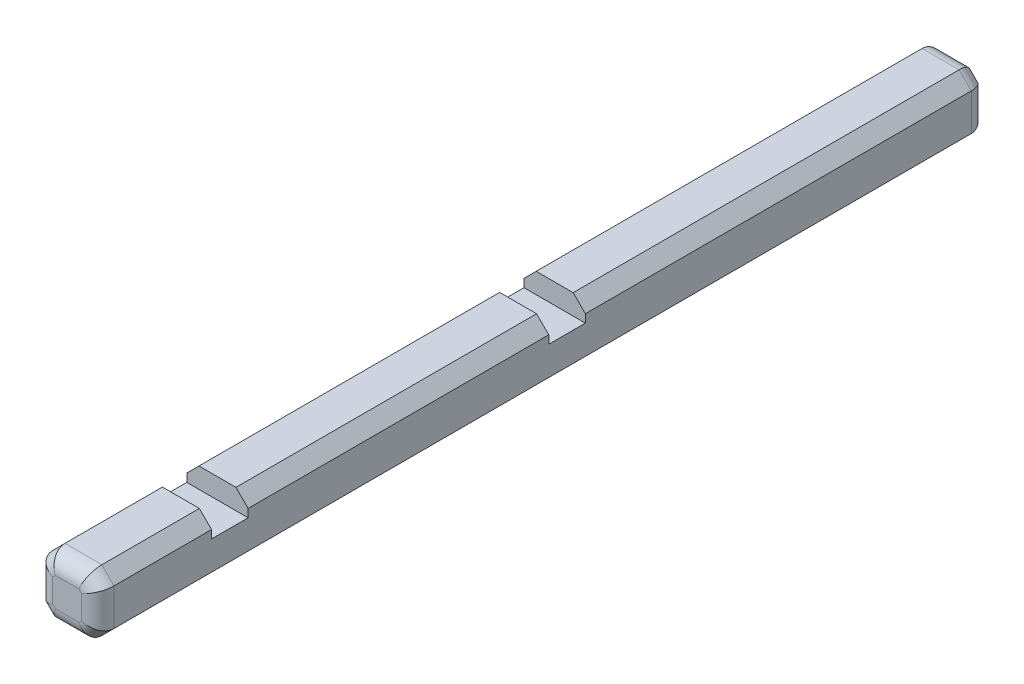
from build123d import *

# Parameters (mm, degrees)
SKETCH1_W           = 7.55
SKETCH1_H           = 7.55
BOSS_EXTRUDE1_DEPTH = 109.5
CHAMFER2_SIZE       = 1.5
SKETCH3_W           = 7.55
SKETCH3_H           = 2.5
CUT_EXTRUDE1_DEPTH  = 4.5
SKETCH4_W           = 7.55
SKETCH4_H           = 2.5
CUT_EXTRUDE2_DEPTH  = 4.5
FILLET1_R           = 2


with BuildPart() as part:
    # Sketch1 → Boss-Extrude1 (new body)
    with BuildSketch(Plane.XY):
        Rectangle(SKETCH1_W, SKETCH1_H)
    extrude(amount=BOSS_EXTRUDE1_DEPTH)

    # Chamfer2
    chamfer2_edges = [part.edges().sort_by_distance(p)[0] for p in [
        (3.775, -3.775, 54.75),
        (-3.775, -3.775, 54.75),
        (3.775, 3.775, 54.75),
        (-3.775, 3.775, 54.75),
    ]]
    chamfer(chamfer2_edges, length=CHAMFER2_SIZE)

    # Sketch3 → Cut-Extrude1 (cut)
    with BuildSketch(Plane(origin=(0, 0, 54), x_dir=(-1, 0, 0), z_dir=(0, 0, -1))):
        with Locations((0, 2.525)):
            Rectangle(SKETCH3_W, SKETCH3_H)
    extrude(amount=CUT_EXTRUDE1_DEPTH, mode=Mode.SUBTRACT)

    # Sketch4 → Cut-Extrude2 (cut)
    with BuildSketch(Plane(origin=(0, 0, 95.5), x_dir=(-1, 0, 0), z_dir=(0, 0, -1))):
        with Locations((0, 2.525)):
            Rectangle(SKETCH4_W, SKETCH4_H)
    extrude(amount=CUT_EXTRUDE2_DEPTH, mode=Mode.SUBTRACT)

    # Fillet1
    fillet1_edges = [part.edges().sort_by_distance(p)[0] for p in [
        (0, 3.775, 0),
        (-3.775, 0, 0),
        (0, -3.775, 0),
        (3.775, 0, 0),
        (-3.775, 0, 109.5),
        (0, 3.775, 109.5),
        (3.775, 0, 109.5),
        (0, -3.775, 109.5),
        (3.025, 3.025, 0),
        (-3.025, 3.025, 0),
        (-3.025, -3.025, 0),
        (3.025, -3.025, 0),
        (-3.025, -3.025, 109.5),
        (-3.025, 3.025, 109.5),
        (3.025, 3.025, 109.5),
        (3.025, -3.025, 109.5),
    ]]
    fillet(fillet1_edges, radius=FILLET1_R)


solid = part.part
